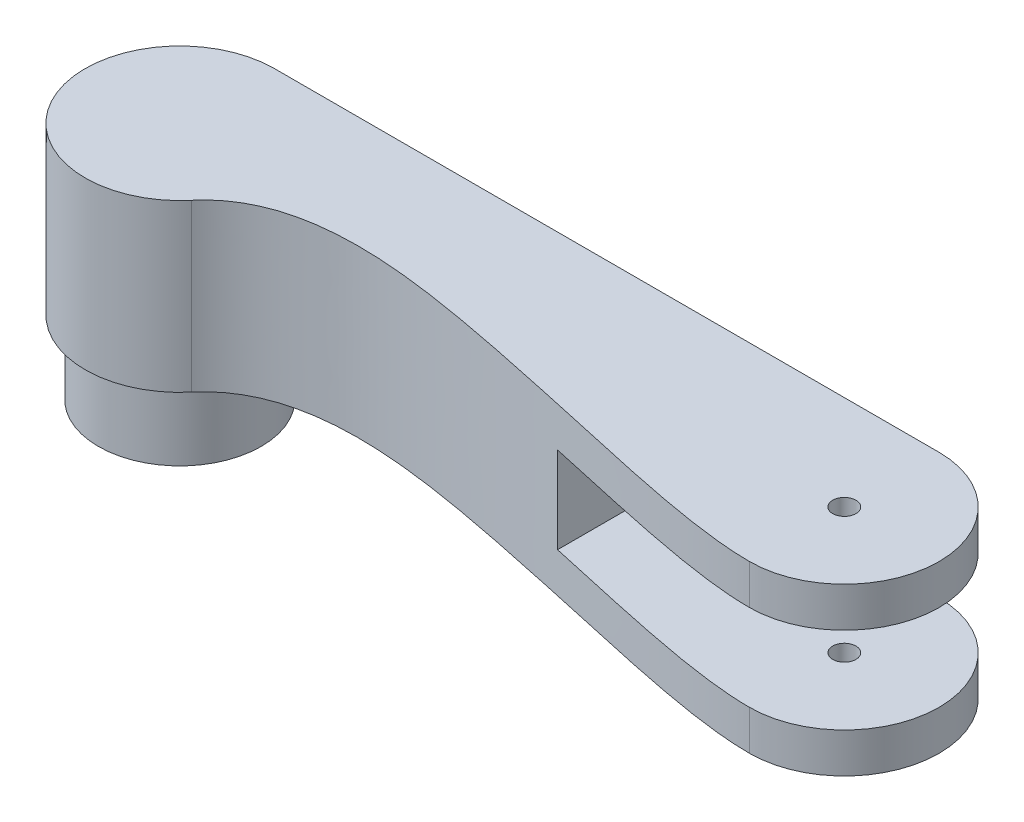
from build123d import *

# Parameters (mm, degrees)
BOSS_EXTRUDE1_DEPTH = 6
SKETCH3_R           = 1.75
CUT_EXTRUDE2_DEPTH  = 67.08422656
BOSS_EXTRUDE2_DEPTH = 13
BOSS_EXTRUDE3_DEPTH = 6
CUT_EXTRUDE3_REACH  = 72.4
SKETCH6_R           = 1.75
CUT_EXTRUDE4_REACH  = 72.4
SKETCH8_R           = 12.25
BOSS_EXTRUDE4_DEPTH = 11
SKETCH9_R           = 2.55
SKETCH9_R_2         = 3
CUT_EXTRUDE5_DEPTH  = 6


with BuildPart() as part:
    # Sketch1 → Boss-Extrude1 (new body)
    with BuildSketch(Plane(origin=(0, 0, 0), x_dir=(1, 0, 0), z_dir=(0, 1, 0))):
        with BuildLine():
            Line((-50, 14.25), (50, 14.25))
            ThreePointArc((50, 14.25), (64.25, 0), (50, -14.25))
            Line((50, -14.25), (-50, -14.25))
            ThreePointArc((-50, -14.25), (-64.25, 0), (-50, 14.25))
        make_face()
    extrude(amount=BOSS_EXTRUDE1_DEPTH)

    # Sketch3 → Cut-Extrude2 (cut, through all)
    with BuildSketch(Plane.XZ):
        with Locations((50, 0)):
            Circle(SKETCH3_R)
    extrude(amount=-CUT_EXTRUDE2_DEPTH, mode=Mode.SUBTRACT)

    # Sketch4 → Boss-Extrude2 (add)
    with BuildSketch(Plane(origin=(0, 6, 0), x_dir=(1, 0, 0), z_dir=(0, 1, 0))):
        with BuildLine():
            Line((-50, 14.25), (15, 14.25))
            Line((15, 14.25), (15, -14.25))
            Line((15, -14.25), (-50, -14.25))
            ThreePointArc((-50, -14.25), (-64.25, 0), (-50, 14.25))
        make_face()
    extrude(amount=BOSS_EXTRUDE2_DEPTH)

    # Sketch5 → Boss-Extrude3 (add)
    with BuildSketch(Plane(origin=(0, 19, 0), x_dir=(1, 0, 0), z_dir=(0, 1, 0))):
        with BuildLine():
            Line((-50, 14.25), (50, 14.25))
            ThreePointArc((50, 14.25), (64.25, 0), (50, -14.25))
            Line((50, -14.25), (-50, -14.25))
            ThreePointArc((-50, -14.25), (-64.25, 0), (-50, 14.25))
        make_face()
    extrude(amount=BOSS_EXTRUDE3_DEPTH)

    # Sketch6 → Cut-Extrude3 (cut, up to next)
    with BuildSketch(Plane(origin=(0, 25, 0), x_dir=(1, 0, 0), z_dir=(0, 1, 0)), mode=Mode.PRIVATE) as cut_extrude3_sk1:
        with Locations((50, 0)):
            Circle(SKETCH6_R)
    cut_extrude3_tool1 = extrude(cut_extrude3_sk1.sketch, amount=-CUT_EXTRUDE3_REACH, mode=Mode.PRIVATE) & part.part
    add(cut_extrude3_tool1.solids().sort_by_distance((50, 25, 0))[0], mode=Mode.SUBTRACT)

    # Sketch7 → Cut-Extrude4 (cut, up to next)
    with BuildSketch(Plane(origin=(0, 25, 0), x_dir=(1, 0, 0), z_dir=(0, 1, 0)), mode=Mode.PRIVATE) as cut_extrude4_sk1:
        with BuildLine():
            ThreePointArc((-39.07315683, -9.146944754), (-43.970135273, -12.911360555), (-50, -14.25))
            Line((-50, -14.25), (50, -14.25))
            add(Edge.make_bspline(
                [(-39.07315683, -9.146944754), (-31.514094033, -0.116968526), (5.438655837, -4.645240543), (38.697514387, -14.25), (50, -14.25)],
                knots=[0, 0, 0, 0, 0.435907903, 1, 1, 1, 1], degree=3))
        make_face()
    cut_extrude4_tool1 = extrude(cut_extrude4_sk1.sketch, amount=-CUT_EXTRUDE4_REACH, mode=Mode.PRIVATE) & part.part
    add(cut_extrude4_tool1.solids().sort_by_distance((-8.590717, 25, 9.791359))[0], mode=Mode.SUBTRACT)

    # Sketch8 → Boss-Extrude4 (add)
    with BuildSketch(Plane.XZ):
        with Locations((-50, 0)):
            Circle(SKETCH8_R)
    extrude(amount=BOSS_EXTRUDE4_DEPTH)

    # Sketch9 → Cut-Extrude5 (cut)
    with BuildSketch(Plane.XZ.offset(11)):
        with Locations((-50, 6.75)):
            Circle(SKETCH9_R)
        with Locations((-50, -6.75)):
            Circle(SKETCH9_R)
        with Locations((-50, 0)):
            Circle(SKETCH9_R_2)
    extrude(amount=-CUT_EXTRUDE5_DEPTH, mode=Mode.SUBTRACT)


solid = part.part
